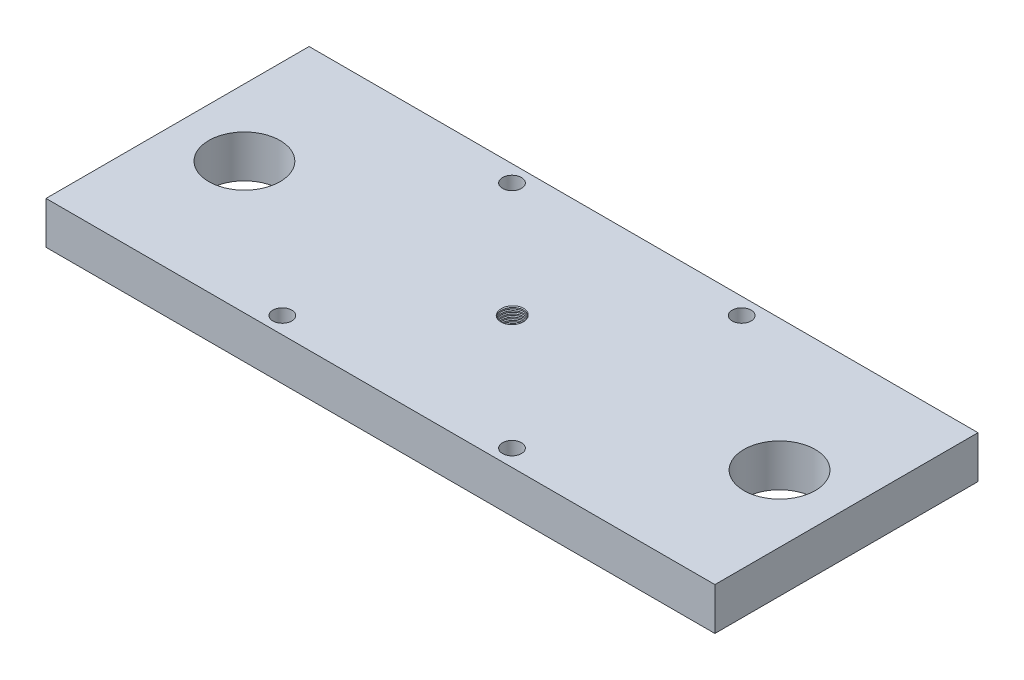
from build123d import *

# Parameters (mm, degrees)
SKETCH1_W                = 300
SKETCH1_H                = 118
SKETCH1_R                = 5
BOSS_EXTRUDE1_DEPTH      = 19
SKETCH4_R                = 16
CUT_EXTRUDE1_DEPTH       = 163.302187293
CUT_EXTRUDE11_DEPTH      = 19
CUT_EXTRUDE11_DEPTH_BACK = 9
SKETCH6_R                = 4.25
CUT_SWEEP1_PITCH         = 1.25


with BuildPart() as part:
    # Sketch1 → Boss-Extrude1 (new body)
    with BuildSketch(Plane(origin=(0, 0, 0), x_dir=(1, 0, 0), z_dir=(0, 1, 0))):
        Rectangle(SKETCH1_W, SKETCH1_H)
        with Locations(Location((0, 0, 0), (0, 0, 270))):
            Circle(SKETCH1_R, mode=Mode.SUBTRACT)
    extrude(amount=BOSS_EXTRUDE1_DEPTH)

    # Sketch4 → Cut-Extrude1 (cut, through all)
    with BuildSketch(Plane(origin=(0, 19, 0), x_dir=(1, 0, 0), z_dir=(0, 1, 0))):
        with Locations(Location((-120, 0, 0), (0, 0, 270))):
            Circle(SKETCH4_R)
        with Locations(Location((120, 0, 0), (0, 0, 270))):
            Circle(SKETCH4_R)
    extrude(amount=-CUT_EXTRUDE1_DEPTH, mode=Mode.SUBTRACT)

    # Sketch6 → Cut-Extrude11 (cut, two sides: drawn at the far end of the back side and taken through both)
    with BuildSketch(Plane(origin=(0, 0, 0), x_dir=(1, 0, 0), z_dir=(0, 1, 0)).offset(-CUT_EXTRUDE11_DEPTH_BACK)):
        with Locations(Location((-51.5, 51.5, 0), (0, 0, 90))):
            Circle(SKETCH6_R)
        with Locations(Location((51.5, 51.5, 0), (0, 0, 90))):
            Circle(SKETCH6_R)
        with Locations(Location((51.5, -51.5, 0), (0, 0, 90))):
            Circle(SKETCH6_R)
        with Locations(Location((-51.5, -51.5, 0), (0, 0, 90))):
            Circle(SKETCH6_R)
    extrude(amount=CUT_EXTRUDE11_DEPTH + CUT_EXTRUDE11_DEPTH_BACK, mode=Mode.SUBTRACT)

    # Cut-Sweep1: arcs per turn and ends read off the stored shape
    # Cut-Sweep1: the profile of Sketch8 profile screwed along a left-hand helix through 17.25 turns, 8 arcs to a turn; built about Z, then put on its axis
    cut_sweep1_z = Axis((0, 0, 0), (0, 0, 1))
    cut_sweep1_corners = [(4.9997, 0, -0.9373125), (4.9997, 0, -1.5626875), (5.5, 0, -1.25)]
    with BuildLine(mode=Mode.PRIVATE) as cut_sweep1_profile:
        Line(cut_sweep1_corners[0], cut_sweep1_corners[1])
        Line(cut_sweep1_corners[1], cut_sweep1_corners[2])
        Line(cut_sweep1_corners[2], cut_sweep1_corners[0])
    cut_sweep1_cap = Face(cut_sweep1_profile.wire())
    cut_sweep1_turn_angles = [0, -22.5, -45, -67.5, -90, -112.5, -135, -157.5, -180, -202.5, -225, -247.5, -270, -292.5, -315, -337.5, -360]
    cut_sweep1_turn_weights = [1, 0.9238795325112867, 1, 0.9238795325112867, 1, 0.9238795325112867, 1, 0.9238795325112867, 1, 0.9238795325112867, 1, 0.9238795325112867, 1, 0.9238795325112867, 1, 0.9238795325112867, 1]
    cut_sweep1_turn_rails = [Edge.make_bspline([Vector(p[0], p[1], 0).rotate(cut_sweep1_z, cut_sweep1_turn_angles[k]) / cut_sweep1_turn_weights[k] + Vector(0, 0, p[2] + -CUT_SWEEP1_PITCH * cut_sweep1_turn_angles[k] / 360) for k in range(17)], [0, 0, 0, 1, 1, 2, 2, 3, 3, 4, 4, 5, 5, 6, 6, 7, 7, 8, 8, 8], 2, cut_sweep1_turn_weights) for p in cut_sweep1_corners]
    cut_sweep1_turn_sides = [Face.make_surface_from_curves(cut_sweep1_turn_rails[p[0]], cut_sweep1_turn_rails[p[1]]) for p in [(0, 1), (1, 2), (2, 0)]]
    cut_sweep1_last_angles = [-6120, -6142.5, -6165, -6187.5, -6210]
    cut_sweep1_last_weights = [1, 0.9238795325112867, 1, 0.9238795325112867, 1]
    cut_sweep1_last_rails = [Edge.make_bspline([Vector(p[0], p[1], 0).rotate(cut_sweep1_z, cut_sweep1_last_angles[k]) / cut_sweep1_last_weights[k] + Vector(0, 0, p[2] + -CUT_SWEEP1_PITCH * cut_sweep1_last_angles[k] / 360) for k in range(5)], [0, 0, 0, 1, 1, 2, 2, 2], 2, cut_sweep1_last_weights) for p in cut_sweep1_corners]
    cut_sweep1_last_sides = [Face.make_surface_from_curves(cut_sweep1_last_rails[p[0]], cut_sweep1_last_rails[p[1]]) for p in [(0, 1), (1, 2), (2, 0)]]
    cut_sweep1 = Plane(origin=(0, 0, 0), x_dir=(-1, 0, 0), z_dir=(0, 1, 0)) * Solid(Shell([*[p.moved(Location((0, 0, CUT_SWEEP1_PITCH * i))) for i in range(17) for p in cut_sweep1_turn_sides], *cut_sweep1_last_sides, cut_sweep1_cap, cut_sweep1_cap.rotate(cut_sweep1_z, -6210).moved(Location((0, 0, -CUT_SWEEP1_PITCH * -6210 / 360)))]))
    add(cut_sweep1, mode=Mode.SUBTRACT)


solid = part.part
